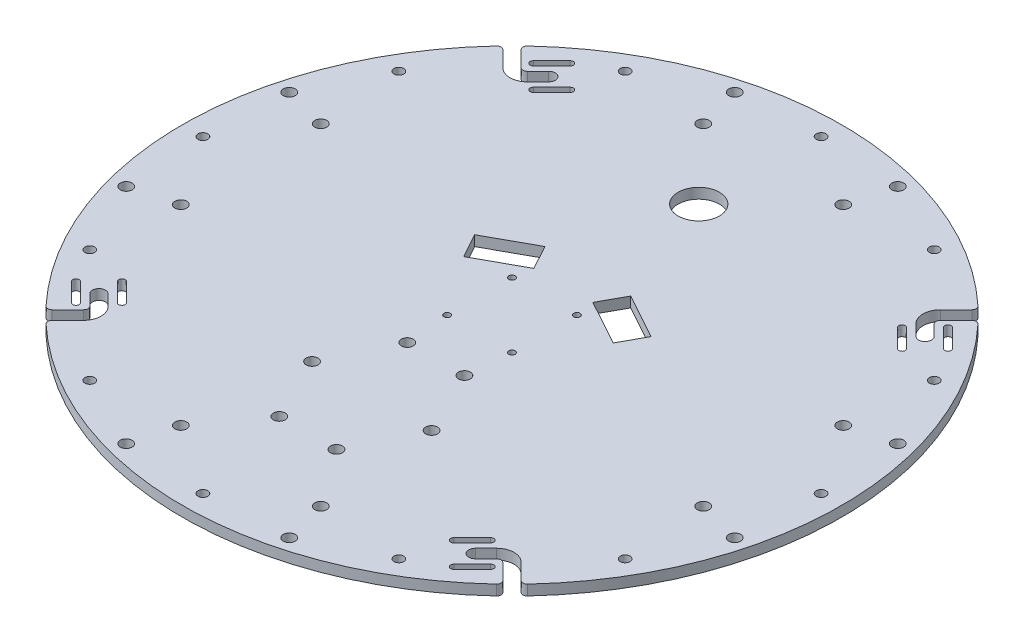
from build123d import *

# Parameters (mm, degrees)
SKETCH1_R                = 152.4
BOSS_EXTRUDE1_DEPTH      = 4.7625
F_8_CLEARANCE_HOLE1_D    = 4.4958
CIRPATTERN1_COUNT        = 12
M2_5_CLEARANCE_HOLE1_D   = 2.9
CUT_EXTRUDE1_DEPTH       = 216.578759172
FILLET1_R                = 3
FILLET2_R                = 2
FILLET3_R                = 8
CIRPATTERN2_COUNT        = 4
FILLET1_OF_CIRPATTERN2_R = 3
FILLET2_OF_CIRPATTERN2_R = 2
FILLET3_OF_CIRPATTERN2_R = 8
M5_CLEARANCE_HOLE1_D     = 5.5
M5_CLEARANCE_HOLE2_D     = 5.5
CIRPATTERN3_COUNT        = 12
CUT_EXTRUDE3_REACH       = 217.579
SKETCH15_R               = 9.525
CUT_EXTRUDE4_REACH       = 217.579


with BuildPart() as part:
    # Sketch1 → Boss-Extrude1 (new body)
    with BuildSketch(Plane(origin=(0, 0, 0), x_dir=(1, 0, 0), z_dir=(0, 1, 0))):
        with Locations(Location((0, 0, 0), (0, 0, 90))):
            Circle(SKETCH1_R)
    extrude(amount=BOSS_EXTRUDE1_DEPTH)

    # #8 Clearance Hole1 (through all)
    with Locations(Plane(origin=(0, 4.7625, 0), x_dir=(1, 0, 0), z_dir=(0, 1, 0))):
        with Locations((0, -142.875)):
            f_8_clearance_hole1 = Hole(F_8_CLEARANCE_HOLE1_D / 2)

    # CirPattern1: #8 Clearance Hole1 ×12 about axis
    cirpattern1_axis = Axis((0, 0, 0), (0, 1, 0))
    for i in range(1, CIRPATTERN1_COUNT):
        add(f_8_clearance_hole1.rotate(cirpattern1_axis, i * 360 / CIRPATTERN1_COUNT), mode=Mode.SUBTRACT)

    # M2.5 Clearance Hole1 (through all)
    with Locations(Plane(origin=(0, 4.7625, 0), x_dir=(1, 0, 0), z_dir=(0, 1, 0))):
        with Locations((-15, -15), (-15, 15), (15, 15), (15, -15)):
            Hole(M2_5_CLEARANCE_HOLE1_D / 2)

    # Sketch8 → Cut-Extrude1 (cut, through all)
    with BuildSketch(Plane(origin=(0, 4.7625, 0), x_dir=(1, 0, 0), z_dir=(0, 1, 0))):
        Polygon((105.641753109, -109.884393796), (95.464119439, -99.706760126), (86.978838065, -108.192041501), (82.736197378, -103.949400814), (95.464119439, -91.221478752), (109.884393796, -105.641753109), align=None)
        with BuildLine():
            Line((86.271731284, -113.141788969), (94.757012658, -104.656507595))
            ThreePointArc((94.757012658, -104.656507595), (96.878333002, -104.656507595), (96.878333002, -106.777827938))
            Line((96.878333002, -106.777827938), (88.393051627, -115.263109313))
            ThreePointArc((88.393051627, -115.263109313), (86.271731284, -115.263109313), (86.271731284, -113.141788969))
        make_face()
        with BuildLine():
            Line((77.78644991, -104.656507595), (86.271731284, -96.17122622))
            ThreePointArc((86.271731284, -96.17122622), (86.271731284, -94.049905877), (84.15041094, -94.049905877))
            Line((84.15041094, -94.049905877), (75.665129566, -102.535187251))
            ThreePointArc((75.665129566, -102.535187251), (75.665129566, -104.656507595), (77.78644991, -104.656507595))
        make_face()
    cut_extrude1 = extrude(amount=-CUT_EXTRUDE1_DEPTH, mode=Mode.SUBTRACT)

    # Fillet1
    fillet1_edges = [part.edges().sort_by_distance(p)[0] for p in [
        (86.978838065, 2.38125, 108.192041501),
        (82.736197378, 2.38125, 103.949400814),
    ]]
    fillet(fillet1_edges, radius=FILLET1_R - 0.0001)  # a hair under: the kernel refuses the full size

    # Fillet2
    fillet2_edges = [part.edges().sort_by_distance(p)[0] for p in [
        (105.620871949, 2.38125, 109.863512636),
        (109.863512636, 2.38125, 105.620871949),
        (95.464119439, 2.38125, 99.706760126),
    ]]
    fillet(fillet2_edges, radius=FILLET2_R)

    # Fillet3
    fillet3_edges = [part.edges().sort_by_distance(p)[0] for p in [
        (95.464119439, 2.38125, 91.221478752),
    ]]
    fillet(fillet3_edges, radius=FILLET3_R)

    # CirPattern2: Cut-Extrude1 ×4 about axis
    cirpattern2_axis = Axis((0, 0, 0), (0, 1, 0))
    for i in range(1, CIRPATTERN2_COUNT):
        add(cut_extrude1.rotate(cirpattern2_axis, i * 360 / CIRPATTERN2_COUNT), mode=Mode.SUBTRACT)

    # Fillet1 of CirPattern2
    fillet1_of_cirpattern2_edges = [part.edges().sort_by_distance(p)[0] for p in [
        (108.192041501, 2.38125, -86.978838065),
        (103.949400814, 2.38125, -82.736197378),
        (-86.978838065, 2.38125, -108.192041501),
        (-82.736197378, 2.38125, -103.949400814),
        (-108.192041501, 2.38125, 86.978838065),
        (-103.949400814, 2.38125, 82.736197378),
    ]]
    fillet(fillet1_of_cirpattern2_edges, radius=FILLET1_OF_CIRPATTERN2_R - 0.0001)  # a hair under: the kernel refuses the full size

    # Fillet2 of CirPattern2
    fillet2_of_cirpattern2_edges = [part.edges().sort_by_distance(p)[0] for p in [
        (109.863512636, 2.38125, -105.620871949),
        (105.620871949, 2.38125, -109.863512636),
        (99.706760126, 2.38125, -95.464119439),
        (-105.620871949, 2.38125, -109.863512636),
        (-109.863512636, 2.38125, -105.620871949),
        (-95.464119439, 2.38125, -99.706760126),
        (-109.863512636, 2.38125, 105.620871949),
        (-105.620871949, 2.38125, 109.863512636),
        (-99.706760126, 2.38125, 95.464119439),
    ]]
    fillet(fillet2_of_cirpattern2_edges, radius=FILLET2_OF_CIRPATTERN2_R)

    # Fillet3 of CirPattern2
    fillet3_of_cirpattern2_edges = [part.edges().sort_by_distance(p)[0] for p in [
        (91.221478752, 2.38125, -95.464119439),
        (-95.464119439, 2.38125, -91.221478752),
        (-91.221478752, 2.38125, 95.464119439),
    ]]
    fillet(fillet3_of_cirpattern2_edges, radius=FILLET3_OF_CIRPATTERN2_R)

    # M5 Clearance Hole1 (through all)
    with Locations(Plane(origin=(0, 4.7625, 0), x_dir=(1, 0, 0), z_dir=(0, 1, 0))):
        with Locations((-13.2, -35.21), (13.2, -35.21), (27.62, -64.79), (13.2, -94.36), (-13.2, -94.36), (-27.62, -64.79)):
            Hole(M5_CLEARANCE_HOLE1_D / 2)

    # M5 Clearance Hole2 (through all)
    with Locations(Plane(origin=(0, 4.7625, 0), x_dir=(1, 0, 0), z_dir=(0, 1, 0))):
        with Locations((32.354102414, -120.747154041), (37.685774743, -140.645226063)):
            m5_clearance_hole2 = Hole(M5_CLEARANCE_HOLE2_D / 2)

    # CirPattern3: M5 Clearance Hole2 ×12 about axis, 4 skipped
    cirpattern3_axis = Axis((0, 0, 0), (0, -1, 0))
    add([m5_clearance_hole2.rotate(cirpattern3_axis, i * 360 / CIRPATTERN3_COUNT) for i in range(1, CIRPATTERN3_COUNT) if i not in (2, 5, 8, 11)], mode=Mode.SUBTRACT)

    # Sketch15 → Cut-Extrude3 (cut, up to next)
    with BuildSketch(Plane(origin=(0, 4.7625, 0), x_dir=(1, 0, 0), z_dir=(0, 1, 0)), mode=Mode.PRIVATE) as cut_extrude3_sk1:
        with Locations(Location((-1.242160376, 87.572306541, 0), (0, 0, 270))):
            Circle(SKETCH15_R)
    cut_extrude3_tool1 = extrude(cut_extrude3_sk1.sketch, amount=-CUT_EXTRUDE3_REACH, mode=Mode.PRIVATE) & part.part
    add(cut_extrude3_tool1.solids().sort_by_distance((-1.24216, 4.7625, -87.572307))[0], mode=Mode.SUBTRACT)

    # Sketch16 → Cut-Extrude4 (cut, up to next)
    with BuildSketch(Plane(origin=(0, 4.7625, 0), x_dir=(1, 0, 0), z_dir=(0, 1, 0)), mode=Mode.PRIVATE) as cut_extrude4_sk1:
        Polygon((40.769638118, 23.532806086), (34.565538825, 12.232482372), (13.617375959, 23.733434534), (19.821475253, 35.033758247), align=None)
    cut_extrude4_tool1 = extrude(cut_extrude4_sk1.sketch, amount=-CUT_EXTRUDE4_REACH, mode=Mode.PRIVATE) & part.part
    # Sketch16 → Cut-Extrude4 (cut, up to next)
    with BuildSketch(Plane(origin=(0, 4.7625, 0), x_dir=(1, 0, 0), z_dir=(0, 1, 0)), mode=Mode.PRIVATE) as cut_extrude4_sk2:
        Polygon((-19.821475253, 35.033758247), (-13.617375959, 23.733434534), (-34.565538825, 12.232482372), (-40.769638118, 23.532806086), align=None)
    cut_extrude4_tool2 = extrude(cut_extrude4_sk2.sketch, amount=-CUT_EXTRUDE4_REACH, mode=Mode.PRIVATE) & part.part
    add(cut_extrude4_tool1.solids().sort_by_distance((27.193507, 4.7625, -23.63312))[0], mode=Mode.SUBTRACT)
    add(cut_extrude4_tool2.solids().sort_by_distance((-27.193507, 4.7625, -23.63312))[0], mode=Mode.SUBTRACT)


solid = part.part
